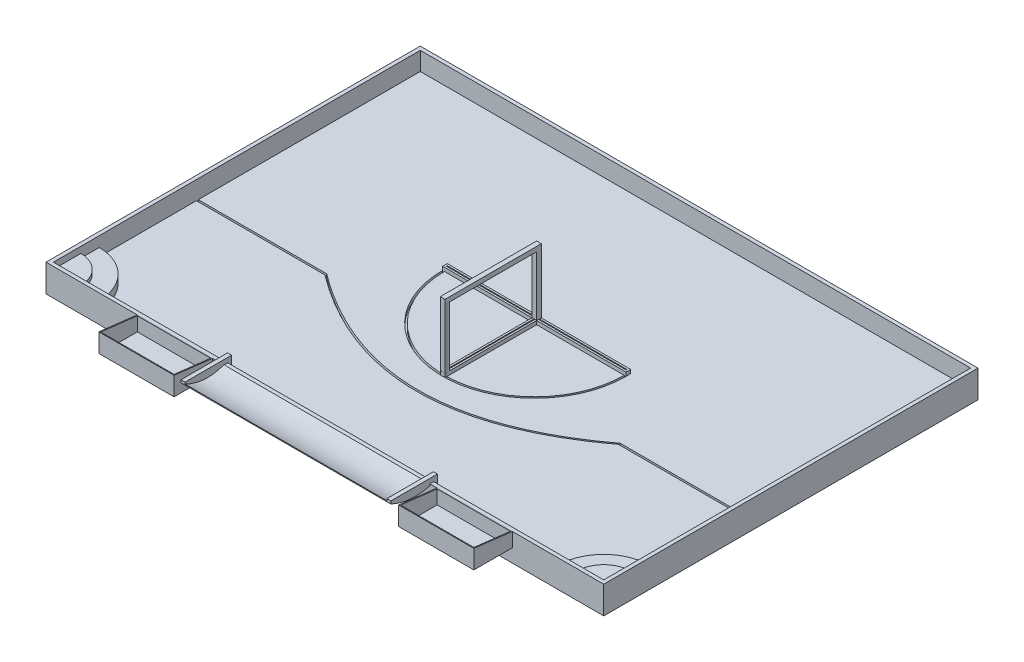
from build123d import *

# Parameters (mm, degrees)
ESQUISSE1_W             = 3040
ESQUISSE1_H             = 2040
BASE_TABLE_DEPTH        = 50
LIGNE_DEPTH             = 20
ESQUISSE3_W             = 3040
ESQUISSE3_H             = 2040
ESQUISSE3_W_2           = 3000
ESQUISSE3_H_2           = 2000
EXT_DEPTH               = 100
COQ_BAS_DEPTH           = 44
COQ_HAUT_DEPTH          = 22
POISSON_START           = -75
ESQUISSE8_W             = 410
ESQUISSE8_H             = 210
ESQUISSE8_W_2           = 400
ESQUISSE8_H_2           = 200
POISSON_EXT_DEPTH       = 100
ESQUISSE9_W             = 410
ESQUISSE9_H             = 210
POISSON_FOND_DEPTH      = 2
MILIEU_VIDE_DEPTH       = 20
MILIEU_BOIS_DEPTH       = 20
MILIEU_BOIS_2_DEPTH     = 350
ESQUISSE13_W            = 25.510370176
ESQUISSE13_H            = 524.677762122
MILIEU_BOIS_3_DEPTH     = 25
ENL_V_START             = -411
ENL_V_MAT_EXTRU_1_DEPTH = 3267.006830114
BOSS_EXTRU_1_DEPTH      = 22
BOSS_EXTRU_2_DEPTH      = 550


# Read off the part's stored shape, not the designer's step: MILIEU BOIS 
with BuildPart() as part:
    # Esquisse1 → BASE TABLE (new body)
    with BuildSketch(Plane(origin=(0, 0, 0), x_dir=(1, 0, 0), z_dir=(0, 1, 0))):
        Rectangle(ESQUISSE1_W, ESQUISSE1_H)
    extrude(amount=BASE_TABLE_DEPTH)

    # Esquisse2 → LIGNE (cut)
    with BuildSketch(Plane(origin=(0, 50, 0), x_dir=(1, 0, 0), z_dir=(0, 1, 0))):
        with BuildLine():
            Line((-1500, -210), (-1500, -220))
            Line((-1500, -220), (-800, -220))
            add(Edge.make_bspline(
                [(-800, -220), (0, -820), (800, -220)],
                knots=[0, 0, 0, 1, 1, 1], degree=2))
            Line((800, -220), (1500, -220))
            Line((1500, -220), (1500, -210))
            Line((1500, -210), (800, -210))
            add(Edge.make_bspline(
                [(-800, -210), (0, -810), (800, -210)],
                knots=[0, 0, 0, 1, 1, 1], degree=2))
            Line((-800, -210), (-1500, -210))
        make_face()
    extrude(amount=-LIGNE_DEPTH, mode=Mode.SUBTRACT)

    # Esquisse3 → EXT (add)
    with BuildSketch(Plane(origin=(0, 50, 0), x_dir=(1, 0, 0), z_dir=(0, 1, 0))):
        Rectangle(ESQUISSE3_W, ESQUISSE3_H)
        Rectangle(ESQUISSE3_W_2, ESQUISSE3_H_2, mode=Mode.SUBTRACT)
    extrude(amount=EXT_DEPTH)

    # Esquisse4 → COQ - BAS (add)
    with BuildSketch(Plane(origin=(0, 50, 0), x_dir=(1, 0, 0), z_dir=(0, 1, 0))):
        with BuildLine():
            Line((-1500, -750), (-1500, -1000))
            Line((-1500, -1000), (-1250, -1000))
            ThreePointArc((-1250, -1000), (-1323.223304703, -823.223304703), (-1500, -750))
        make_face()
    coq_bas = extrude(amount=COQ_BAS_DEPTH)

    # Esquisse7 → COQ - HAUT (add)
    with BuildSketch(Plane(origin=(0, 94, 0), x_dir=(1, 0, 0), z_dir=(0, 1, 0))):
        with BuildLine():
            Line((-1500, -850), (-1500, -1000))
            Line((-1500, -1000), (-1350, -1000))
            ThreePointArc((-1350, -1000), (-1393.933982822, -893.933982822), (-1500, -850))
        make_face()
    coq_haut = extrude(amount=COQ_HAUT_DEPTH)

    # SYM -COQ: COQ - BAS, COQ - HAUT across plane
    add(coq_bas.mirror(Plane.ZY))
    add(coq_haut.mirror(Plane.ZY))

    # Esquisse8 → POISSON EXT (add)
    with BuildSketch(Plane(origin=(0, 150, 0), x_dir=(1, 0, 0), z_dir=(0, 1, 0)).offset(POISSON_START)):
        with Locations((-817, -1125)):
            Rectangle(ESQUISSE8_W, ESQUISSE8_H)
        with Locations((-817, -1125)):
            Rectangle(ESQUISSE8_W_2, ESQUISSE8_H_2, mode=Mode.SUBTRACT)
    poisson_ext = extrude(amount=POISSON_EXT_DEPTH)

    # Esquisse9 → POISSON FOND (add)
    with BuildSketch(Plane.XZ.offset(-75)):
        with Locations((-817, 1125)):
            Rectangle(ESQUISSE9_W, ESQUISSE9_H)
    poisson_fond = extrude(amount=POISSON_FOND_DEPTH)

    # Esquisse10 → MILIEU VIDE (cut)
    with BuildSketch(Plane(origin=(0, 50, 0), x_dir=(1, 0, 0), z_dir=(0, 1, 0))):
        with BuildLine():
            Line((-500, 121.899372106), (-490, 121.899372106))
            ThreePointArc((-490, 121.899372106), (0, -368.100627894), (490, 121.899372106))
            Line((490, 121.899372106), (500, 121.899372106))
            ThreePointArc((500, 121.899372106), (0, -378.100627894), (-500, 121.899372106))
        make_face()
    extrude(amount=-MILIEU_VIDE_DEPTH, mode=Mode.SUBTRACT)

    # MILIEU BOIS outline → MILIEU BOIS (add)
    with BuildSketch(Plane(origin=(0, 50, 0), x_dir=(1, 0, 0), z_dir=(0, 1, 0))):
        with BuildLine():
            Line((-500, 121.899372106), (-12.5, 121.899372106))
            Line((-12.5, 121.899372106), (-12.5, -367.781646517))
            Line((-12.5, -367.781646517), (-12.755185088, -377.778390016))
            ThreePointArc((-12.755185088, -377.778390016), (0, -377.941163171), (12.755185088, -377.778390016))
            Line((12.755185088, -377.778390016), (12.5, -367.781646518))
            Line((12.5, -367.781646518), (12.5, 121.899372106))
            Line((12.5, 121.899372106), (500, 121.899372106))
            Line((500, 121.899372106), (500, 146.899372106))
            Line((500, 146.899372106), (-500, 146.899372106))
            Line((-500, 146.899372106), (-500, 121.899372106))
        make_face()
        with BuildLine():
            Line((2.5, 131.899372106), (2.5, -367.934783502))
            ThreePointArc((2.5, -367.934783502), (0, -367.941163171), (-2.5, -367.934783502))
            Line((-2.5, -367.934783502), (-2.5, 131.899372106))
            Line((-2.5, 131.899372106), (-490, 131.899372106))
            Line((-490, 131.899372106), (-490, 136.899372106))
            Line((-490, 136.899372106), (490, 136.899372106))
            Line((490, 136.899372106), (490, 131.899372106))
            Line((490, 131.899372106), (2.5, 131.899372106))
        make_face(mode=Mode.SUBTRACT)
    extrude(amount=MILIEU_BOIS_DEPTH)

    # Esquisse12 → MILIEU BOIS 2 (add)
    with BuildSketch(Plane(origin=(0, 70, 0), x_dir=(1, 0, 0), z_dir=(0, 1, 0))):
        Polygon((-12.602074035, 131.899372106), (-12.5, 121.899372106), (-2.5, 121.899372106), (-2.5, 131.899372106), align=None)
        Polygon((-2.5, 131.899372106), (-2.5, 121.899372106), (2.5, 121.899372106), (2.5, 131.899372106), (12.755185088, 131.899372106), (12.755185088, 136.899372106), (-12.653111053, 136.899372106), (-12.602074035, 131.899372106), align=None)
        Polygon((2.5, 121.899372106), (12.5, 121.899372106), (12.755185088, 121.899372106), (12.755185088, 131.899372106), (2.5, 131.899372106), align=None)
        Polygon((-12.755185088, 146.899372106), (-12.653111053, 136.899372106), (12.755185088, 136.899372106), (12.755185088, 146.899372106), align=None)
        with BuildLine():
            Line((2.5, -352.778390016), (-2.5, -352.778390016))
            Line((-2.5, -352.778390016), (-2.5, -367.934783502))
            ThreePointArc((-2.5, -367.934783502), (0, -367.941163171), (2.5, -367.934783502))
            Line((2.5, -367.934783502), (2.5, -352.778390016))
        make_face()
        with BuildLine():
            Line((-12.5, -367.781646517), (-12.755185088, -377.778390016))
            Line((-12.755185088, -377.778390016), (12.755185088, -377.778390016))
            Line((12.755185088, -377.778390016), (12.5, -367.781646518))
            Line((12.5, -367.781646518), (12.5, -352.778390016))
            Line((12.5, -352.778390016), (2.5, -352.778390016))
            Line((2.5, -352.778390016), (2.5, -367.934783502))
            ThreePointArc((2.5, -367.934783502), (0, -367.941163171), (-2.5, -367.934783502))
            Line((-2.5, -367.934783502), (-2.5, -352.778390016))
            Line((-2.5, -352.778390016), (-12.5, -352.778390016))
            Line((-12.5, -352.778390016), (-12.5, -367.781646517))
        make_face()
    extrude(amount=MILIEU_BOIS_2_DEPTH)

    # Esquisse13 → MILIEU BOIS 3 (add)
    with BuildSketch(Plane(origin=(0, 420, 0), x_dir=(1, 0, 0), z_dir=(0, 1, 0))):
        with Locations((0, -115.439508955)):
            Rectangle(ESQUISSE13_W, ESQUISSE13_H)
    extrude(amount=-MILIEU_BOIS_3_DEPTH)

    # Esquisse16 → Enlèv. mat.-Extru.1 (cut)
    with BuildSketch(Plane.ZY.offset(1022).offset(ENL_V_START)):
        Polygon((1020, 150), (1230, 175), (1020, 175), align=None)
    enl_v_mat_extru_1 = extrude(amount=ENL_V_MAT_EXTRU_1_DEPTH, mode=Mode.SUBTRACT)

    # Esquisse18 → Boss.-Extru.1 (add)
    with BuildSketch(Plane(origin=(-572, 0, 0), x_dir=(0, 0, -1), z_dir=(1, 0, 0))):
        with BuildLine():
            Line((-1020, 140), (-1020, 150))
            Line((-1020, 150), (-1000, 150))
            Line((-1000, 150), (-1000, 75))
            Line((-1000, 75), (-978, 75))
            Line((-978, 75), (-978, 175))
            Line((-978, 175), (-1232, 175))
            Line((-1232, 175), (-1232, 160))
            add(Edge.make_bspline(
                [(-1232, 160), (-1126.857109978, 111.909446545), (-1020, 140)],
                knots=[0, 0, 0, 1, 1, 1], degree=2))
        make_face()
    boss_extru_1 = extrude(amount=BOSS_EXTRU_1_DEPTH)

    # Esquisse20 → Boss.-Extru.2 (add)
    with BuildSketch(Plane(origin=(-550, 0, 0), x_dir=(0, 0, -1), z_dir=(1, 0, 0))):
        with BuildLine():
            Line((-1232, 165), (-1232, 160))
            add(Edge.make_bspline(
                [(-1232, 160), (-1127.265561017, 108.15552864), (-1020, 145)],
                knots=[0, 0, 0, 1, 1, 1], degree=2))
            Line((-1020, 145), (-1020, 150))
            add(Edge.make_bspline(
                [(-1020, 150), (-1127.265561017, 113.15552864), (-1232, 165)],
                knots=[0, 0, 0, 1, 1, 1], degree=2))
        make_face()
    boss_extru_2 = extrude(amount=BOSS_EXTRU_2_DEPTH)

    # Symétrie1: POISSON EXT, POISSON FOND, Enlèv. mat.-Extru.1, Boss.-Extru.1, Boss.-Extru.2 across plane
    add(poisson_ext.mirror(Plane.ZY))
    add(poisson_fond.mirror(Plane.ZY))
    add(enl_v_mat_extru_1.mirror(Plane.ZY), mode=Mode.SUBTRACT)
    add(boss_extru_1.mirror(Plane.ZY))
    add(boss_extru_2.mirror(Plane.ZY))


solid = part.part
